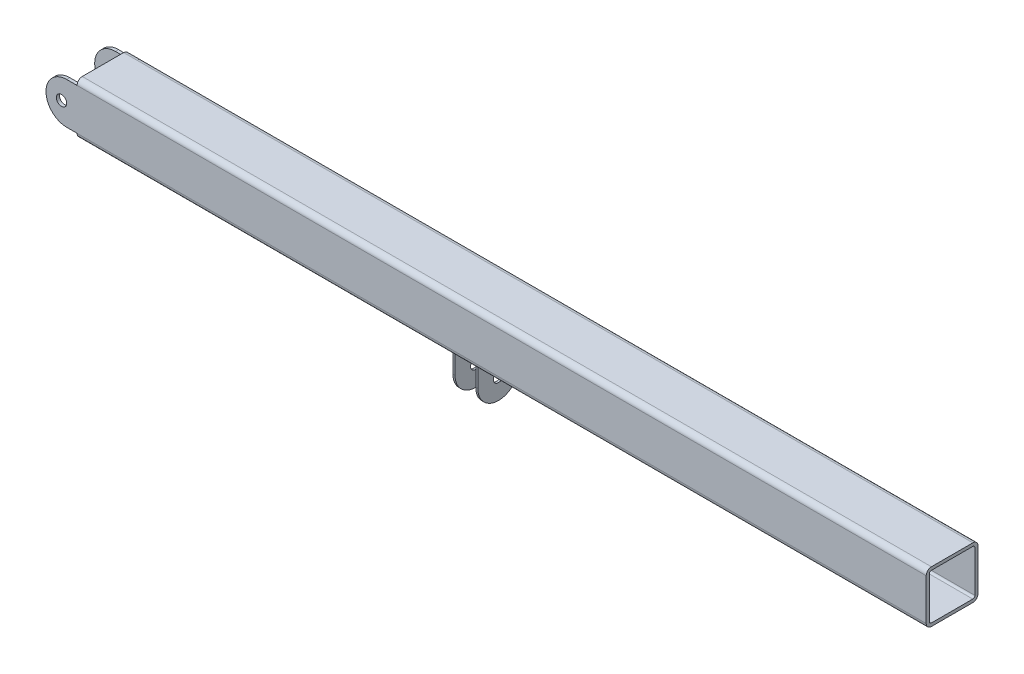
from build123d import *

# Parameters (mm, degrees)
EXTRUDE_THIN1_DEPTH      = 820
SKETCH3_R                = 5
BOSS_EXTRUDE2_DEPTH      = 3
BOSS_EXTRUDE3_START      = -47
SKETCH3_3_R              = 5
BOSS_EXTRUDE3_DEPTH      = 3
BOSS_EXTRUDE4_DEPTH      = 40
BOSS_EXTRUDE4_DEPTH_BACK = 10
FILLET1_R                = 20
SKETCH7_R                = 5
CUT_EXTRUDE3_DEPTH       = 444.504548848


with BuildPart() as part:
    # Sketch1 → Extrude-Thin1 (new body)
    with BuildSketch(Plane(origin=(0, 0, 0), x_dir=(0, 0, -1), z_dir=(1, 0, 0))):
        with BuildLine():
            Line((-25, 20), (-25, -20))
            ThreePointArc((-25, -20), (-23.535533906, -23.535533906), (-20, -25))
            Line((-20, -25), (20, -25))
            ThreePointArc((20, -25), (23.535533906, -23.535533906), (25, -20))
            Line((25, -20), (25, 20))
            ThreePointArc((25, 20), (23.535533906, 23.535533906), (20, 25))
            Line((20, 25), (-20, 25))
            ThreePointArc((-20, 25), (-23.535533906, 23.535533906), (-25, 20))
        make_face()
        with BuildLine():
            Line((-22, 20), (-22, -20))
            ThreePointArc((-22, -20), (-21.414213562, -21.414213562), (-20, -22))
            Line((-20, -22), (20, -22))
            ThreePointArc((20, -22), (21.414213562, -21.414213562), (22, -20))
            Line((22, -20), (22, 20))
            ThreePointArc((22, 20), (21.414213562, 21.414213562), (20, 22))
            Line((20, 22), (-20, 22))
            ThreePointArc((-20, 22), (-21.414213562, 21.414213562), (-22, 20))
        make_face(mode=Mode.SUBTRACT)
    extrude(amount=EXTRUDE_THIN1_DEPTH)

    # Sketch3 → Boss-Extrude2 (add)
    with BuildSketch(Plane(origin=(0, 0, -25), x_dir=(-1, 0, 0), z_dir=(0, 0, -1))):
        with BuildLine():
            Line((0, 20), (10, 20))
            ThreePointArc((10, 20), (30, 0), (10, -20))
            Line((10, -20), (0, -20))
            Line((0, -20), (0, 20))
        make_face()
        with Locations((15, 0)):
            Circle(SKETCH3_R, mode=Mode.SUBTRACT)
    extrude(amount=-BOSS_EXTRUDE2_DEPTH)

    # Sketch3<3> → Boss-Extrude3 (add)
    with BuildSketch(Plane(origin=(0, 0, -25), x_dir=(-1, 0, 0), z_dir=(0, 0, -1)).offset(BOSS_EXTRUDE3_START)):
        with BuildLine():
            Line((0, 20), (10, 20))
            ThreePointArc((10, 20), (30, 0), (10, -20))
            Line((10, -20), (0, -20))
            Line((0, -20), (0, 20))
        make_face()
        with Locations((15, 0)):
            Circle(SKETCH3_3_R, mode=Mode.SUBTRACT)
    extrude(amount=-BOSS_EXTRUDE3_DEPTH)

    # Sketch5 → Boss-Extrude4 (add, two sides: drawn at the far end of the back side and taken through both)
    with BuildSketch(Plane.XZ.offset(25).offset(-BOSS_EXTRUDE4_DEPTH_BACK)):
        Polygon((358, -19.999999922), (358.002493701, 20), (360, 20), (360, -20), align=None)
        Polygon((380, 20), (381.997506299, 20), (382, -19.999999922), (380, -20), align=None)
    extrude(amount=BOSS_EXTRUDE4_DEPTH + BOSS_EXTRUDE4_DEPTH_BACK)

    # Fillet1
    fillet1_edges = [part.edges().sort_by_distance(p)[0] for p in [
        (380.99875315, -65, 20),
        (381, -65, -19.999999961),
        (359.00124685, -65, 20),
        (359, -65, -19.999999961),
    ]]
    fillet(fillet1_edges, radius=FILLET1_R - 0.0001)  # a hair under: the kernel refuses the full size

    # Sketch7 → Cut-Extrude3 (cut, through all)
    with BuildSketch(Plane(origin=(381.998751665, 0, 0.023814765), x_dir=(6.234251963554982e-05, 0, -0.9999999980567051), z_dir=(0.9999999980567051, 0, 6.234251963554982e-05))):
        with Locations((0.023814765, -45)):
            Circle(SKETCH7_R)
    extrude(amount=-CUT_EXTRUDE3_DEPTH, mode=Mode.SUBTRACT)


solid = part.part
